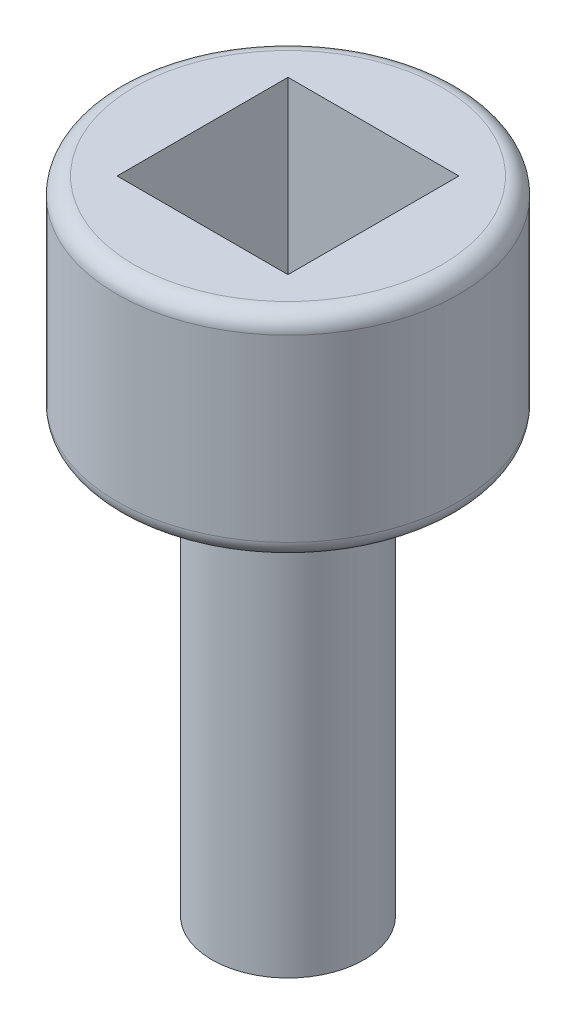
from build123d import *

# Parameters (mm, degrees)
SKETCH1_R           = 2.54
BOSS_EXTRUDE1_DEPTH = 3.175
SKETCH2_R           = 1.1303
BOSS_EXTRUDE2_DEPTH = 9.525
SKETCH3_W           = 2.54
SKETCH3_H           = 2.54
CUT_EXTRUDE1_DEPTH  = 2.54
FILLET3_R           = 0.254


with BuildPart() as part:
    # Sketch1 → Boss-Extrude1 (new body)
    with BuildSketch(Plane(origin=(0, 0, 0), x_dir=(1, 0, 0), z_dir=(0, 1, 0))):
        Circle(SKETCH1_R)
    extrude(amount=-BOSS_EXTRUDE1_DEPTH)

    # Sketch2 → Boss-Extrude2 (add)
    with BuildSketch(Plane(origin=(0, 0, 0), x_dir=(1, 0, 0), z_dir=(0, 1, 0))):
        Circle(SKETCH2_R)
    extrude(amount=-BOSS_EXTRUDE2_DEPTH)

    # Sketch3 → Cut-Extrude1 (cut)
    with BuildSketch(Plane(origin=(0, 0, 0), x_dir=(1, 0, 0), z_dir=(0, 1, 0))):
        Rectangle(SKETCH3_W, SKETCH3_H)
    extrude(amount=-CUT_EXTRUDE1_DEPTH, mode=Mode.SUBTRACT)

    # Fillet3
    fillet3_edges = [part.edges().sort_by_distance(p)[0] for p in [
        (-2.54, 0, 0),
        (-2.54, -3.175, 0),
    ]]
    fillet(fillet3_edges, radius=FILLET3_R)


solid = part.part
